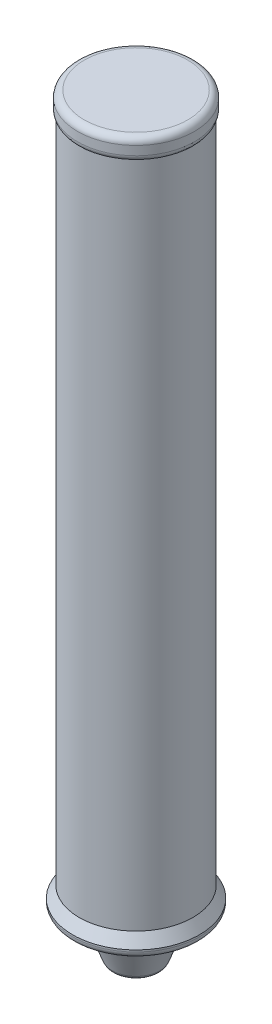
from build123d import *

# Parameters (mm, degrees)
SKETCH1_R           = 8.5
BOSS_EXTRUDE1_DEPTH = 100
SKETCH2_R           = 8.75
BOSS_EXTRUDE2_DEPTH = 3
FILLET5_R           = 1
FILLET8_R           = 1
SKETCH5_R           = 9.5
BOSS_EXTRUDE3_DEPTH = 3
FILLET10_R          = 1
CHAMFER2_SIZE2      = 1
CHAMFER2_SIZE       = 1.732050808
SKETCH6_R           = 6
BOSS_EXTRUDE4_DEPTH = 7
CUT_EXTRUDE1_DEPTH  = 7
CHAMFER4_SIZE2      = 2.687048245
CHAMFER4_SIZE       = 7
FILLET12_R          = 1


with BuildPart() as part:
    # Sketch1 → Boss-Extrude1 (new body)
    with BuildSketch(Plane(origin=(0, 0, 0), x_dir=(1, 0, 0), z_dir=(0, 1, 0))):
        with Locations(Location((0, 0, 0), (0, 0, 270))):
            Circle(SKETCH1_R)
    extrude(amount=BOSS_EXTRUDE1_DEPTH)

    # Sketch2 → Boss-Extrude2 (add)
    with BuildSketch(Plane(origin=(0, 100, 0), x_dir=(1, 0, 0), z_dir=(0, 1, 0))):
        with Locations(Location((0, 0, 0), (0, 0, 270))):
            Circle(SKETCH2_R)
    extrude(amount=BOSS_EXTRUDE2_DEPTH)

    # Fillet5
    fillet5_edges = [part.edges().sort_by_distance(p)[0] for p in [
        (0, 103, -8.75),
    ]]
    fillet(fillet5_edges, radius=FILLET5_R)

    # Fillet8
    # the kernel refuses this fillet: 1 mm, written as the material it takes off along each edge
    with BuildSketch(Plane(origin=(0, 100, 0), x_dir=(0, 0, 1), z_dir=(-1, 0, 0))) as fillet8_piece_1:
        with BuildLine():
            CenterArc((7.75, 0.661437828), FILLET8_R, 318.590377891, 41.409622109)
            Line((8.5, 0), (8.515, -0.013228757))
            ThreePointArc((8.515, -0.013228757), (8.625, -0.02), (8.75, -0.02))
            Line((8.75, -0.02), (8.77, 0))
            Line((8.77, 0), (8.77, 0.661437828))
            Line((8.77, 0.661437828), (8.75, 0.661437828))
        make_face()
    revolve(axis=Axis((0, 100, 0), (0, 1, 0)), mode=Mode.SUBTRACT)

    # Sketch5 → Boss-Extrude3 (add)
    with BuildSketch(Plane.XZ):
        with Locations(Location((0, 0, 0), (0, 0, 270))):
            Circle(SKETCH5_R)
    extrude(amount=BOSS_EXTRUDE3_DEPTH)

    # Fillet10
    fillet10_edges = [part.edges().sort_by_distance(p)[0] for p in [
        (0, -3, 9.5),
    ]]
    fillet(fillet10_edges, radius=FILLET10_R)

    # Chamfer2
    chamfer2_edges = [part.edges().sort_by_distance(p)[0] for p in [
        (0, 0, 9.5),
    ]]
    chamfer2_side = [part.faces().sort_by_distance(p)[0] for p in [
        (0, -0.02, 9.5),
    ]]
    chamfer(chamfer2_edges, length=CHAMFER2_SIZE - 0.0001, length2=CHAMFER2_SIZE2 - 0.0001, reference=chamfer2_side[0])  # a hair under: the kernel refuses the full size

    # Sketch6 → Boss-Extrude4 (add)
    with BuildSketch(Plane.XZ.offset(3)):
        with Locations(Location((0, 0, 0), (0, 0, 270))):
            Circle(SKETCH6_R)
    extrude(amount=BOSS_EXTRUDE4_DEPTH)

    # Sketch7 → Cut-Extrude1 (cut)
    with BuildSketch(Plane.XZ.offset(10)):
        with BuildLine():
            Line((-1.65, 1.378404875), (-1.65, -1.378404875))
            ThreePointArc((-1.65, -1.378404875), (0, -2.15), (1.65, -1.378404875))
            Line((1.65, -1.378404875), (1.65, 1.378404875))
            ThreePointArc((1.65, 1.378404875), (0, 2.15), (-1.65, 1.378404875))
        make_face()
    extrude(amount=-CUT_EXTRUDE1_DEPTH, mode=Mode.SUBTRACT)

    # Chamfer4
    chamfer4_edges = [part.edges().sort_by_distance(p)[0] for p in [
        (0, -10, 6),
    ]]
    chamfer4_side = [part.faces().sort_by_distance(p)[0] for p in [
        (0, -9.946259035, 6),
    ]]
    chamfer(chamfer4_edges, length=CHAMFER4_SIZE - 0.0001, length2=CHAMFER4_SIZE2 - 0.0001, reference=chamfer4_side[0])  # a hair under: the kernel refuses the full size

    # Fillet11: read off the stored shape, not the designer's step
    # Fillet11 outline → Fillet11 (revolve)
    with BuildSketch(Plane.XY):
        with BuildLine():
            Line((5.261101596, -3), (5.261101596, -4.924896151))
            ThreePointArc((5.261101596, -4.924896151), (6.362624165, -3.527621434), (8.061842876, -3))
            Line((8.061842876, -3), (5.261101596, -3))
        make_face()
    revolve(axis=Axis((0, 0, 0), (0, 1, 0)))

    # Fillet12
    fillet12_edges = [part.edges().sort_by_distance(p)[0] for p in [
        (0, -10, 3.313051755),
    ]]
    fillet(fillet12_edges, radius=FILLET12_R)


solid = part.part
